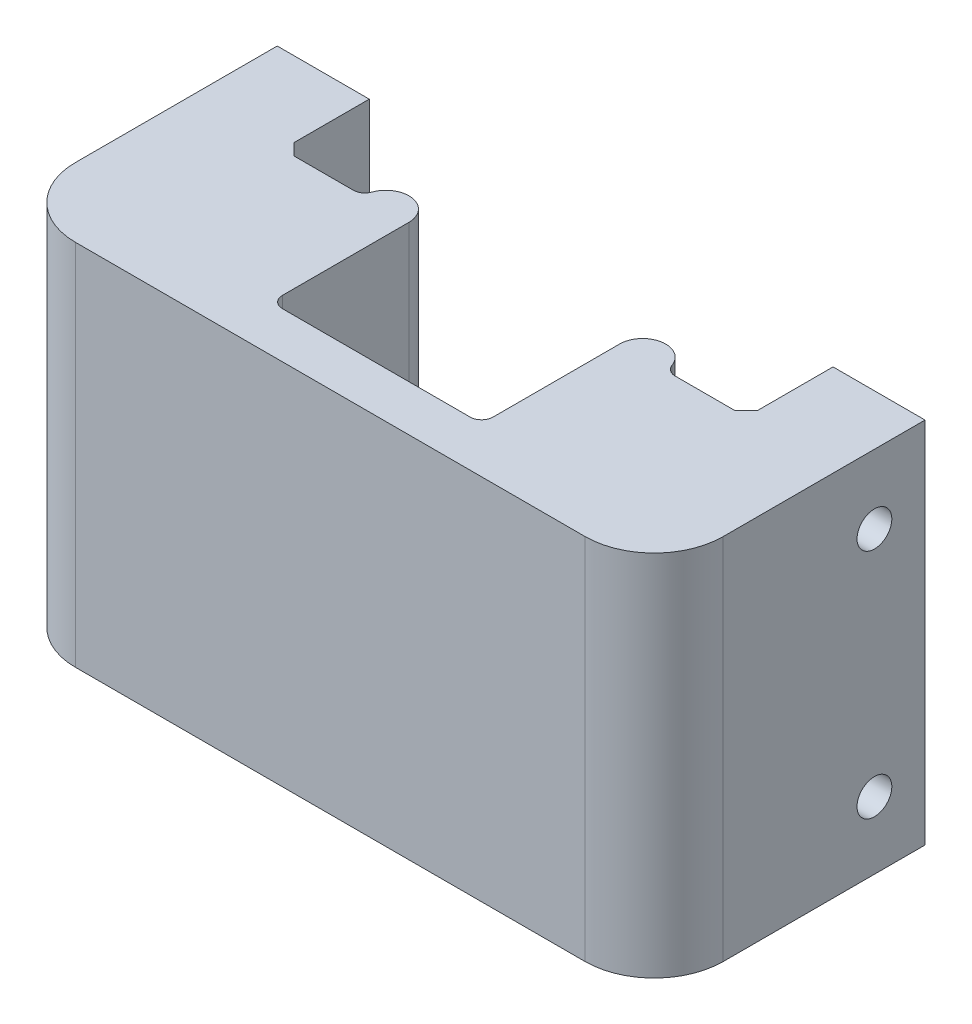
from build123d import *

# Parameters (mm, degrees)
BOSS_EXTRUDE1_DEPTH           = 25.4
CHAMFER1_SIZE                 = 0.79375
SKETCH4_W                     = 1.2
SKETCH4_H                     = 6.35
M2_CLEARANCE_HOLE1_AT_2_COUNT = 2
M2_CLEARANCE_HOLE1_AT_2_PITCH = 16
FILLET1_R                     = 4.7625
FILLET5_R                     = 1.5875
FILLET6_R                     = 1.5875
FILLET7_R                     = 0.79375
SKETCH6_W                     = 1.2
SKETCH6_H                     = 6.35
M2_CLEARANCE_HOLE2_AT_2_COUNT = 2
M2_CLEARANCE_HOLE2_AT_2_PITCH = 16


with BuildPart() as part:
    # Sketch1 → Boss-Extrude1 (new body)
    with BuildSketch(Plane(origin=(0, 0, 0), x_dir=(1, 0, 0), z_dir=(0, 1, 0))):
        with BuildLine():
            Line((0, 0), (0, 5.9944))
            Line((0, 5.9944), (-6.35, 5.9944))
            Line((-6.35, 5.9944), (-6.35, -12.7))
            Line((-6.35, -12.7), (38.354, -12.7))
            Line((38.354, -12.7), (38.354, 5.9944))
            Line((38.354, 5.9944), (32.004, 5.9944))
            Line((32.004, 5.9944), (32.004, 0))
            Line((32.004, 0), (26.44775, 0))
            Line((26.44775, 0), (26.44775, 1.5875))
            Line((26.44775, 1.5875), (23.27275, 1.5875))
            Line((23.27275, 1.5875), (23.27275, -8.73125))
            ThreePointArc((23.27275, -8.73125), (23.040266008, -9.292516008), (22.479, -9.525))
            Line((22.479, -9.525), (9.525, -9.525))
            ThreePointArc((9.525, -9.525), (8.963733992, -9.292516008), (8.73125, -8.73125))
            Line((8.73125, -8.73125), (8.73125, 1.5875))
            Line((8.73125, 1.5875), (5.55625, 1.5875))
            Line((5.55625, 1.5875), (5.55625, 0))
            Line((5.55625, 0), (0, 0))
        make_face()
    extrude(amount=BOSS_EXTRUDE1_DEPTH)

    # Chamfer1
    chamfer1_edges = [part.edges().sort_by_distance(p)[0] for p in [
        (0, 12.7, 0),
        (32.004, 12.7, 0),
    ]]
    chamfer(chamfer1_edges, length=CHAMFER1_SIZE)

    # Sketch4 → M2 Clearance Hole1 (revolve, cut)
    with BuildSketch(Plane(origin=(0, 20.6390625, -2.5), x_dir=(0, 0, -1), z_dir=(0, 1, 0))):
        with Locations((0.6, 3.175)):
            Rectangle(SKETCH4_W, SKETCH4_H)
    m2_clearance_hole1 = revolve(axis=Axis((6.35, 20.6390625, -2.5), (-1, 0, 0)), mode=Mode.SUBTRACT)

    # M2 Clearance Hole1 at 2: M2 Clearance Hole1 ×2
    with Locations(*[(0, -i * M2_CLEARANCE_HOLE1_AT_2_PITCH, 0) for i in range(1, M2_CLEARANCE_HOLE1_AT_2_COUNT)]):
        add(m2_clearance_hole1, mode=Mode.SUBTRACT)

    # Fillet1
    fillet1_edges = [part.edges().sort_by_distance(p)[0] for p in [
        (-6.35, 12.7, 12.7),
        (38.354, 12.7, 12.7),
    ]]
    fillet(fillet1_edges, radius=FILLET1_R)

    # Fillet5
    fillet5_edges = [part.edges().sort_by_distance(p)[0] for p in [
        (5.55625, 12.7, -1.5875),
        (8.73125, 12.7, -1.5875),
    ]]
    fillet(fillet5_edges, radius=FILLET5_R - 0.0001)  # a hair under: the kernel refuses the full size

    # Fillet6
    fillet6_edges = [part.edges().sort_by_distance(p)[0] for p in [
        (23.27275, 12.7, -1.5875),
        (26.44775, 12.7, -1.5875),
    ]]
    fillet(fillet6_edges, radius=FILLET6_R - 0.0001)  # a hair under: the kernel refuses the full size

    # Fillet7
    fillet7_edges = [part.edges().sort_by_distance(p)[0] for p in [
        (5.55625, 12.7, 0),
        (26.44775, 12.7, 0),
    ]]
    fillet(fillet7_edges, radius=FILLET7_R)

    # Sketch6 → M2 Clearance Hole2 (revolve, cut)
    with BuildSketch(Plane(origin=(32.004, 4.6390625, -2.5), x_dir=(0, 0, 1), z_dir=(0, 1, 0))):
        with Locations((0.6, 3.175)):
            Rectangle(SKETCH6_W, SKETCH6_H)
    m2_clearance_hole2 = revolve(axis=Axis((25.654, 4.6390625, -2.5), (1, 0, 0)), mode=Mode.SUBTRACT)

    # M2 Clearance Hole2 at 2: M2 Clearance Hole2 ×2
    with Locations(*[(0, i * M2_CLEARANCE_HOLE2_AT_2_PITCH, 0) for i in range(1, M2_CLEARANCE_HOLE2_AT_2_COUNT)]):
        add(m2_clearance_hole2, mode=Mode.SUBTRACT)


solid = part.part
